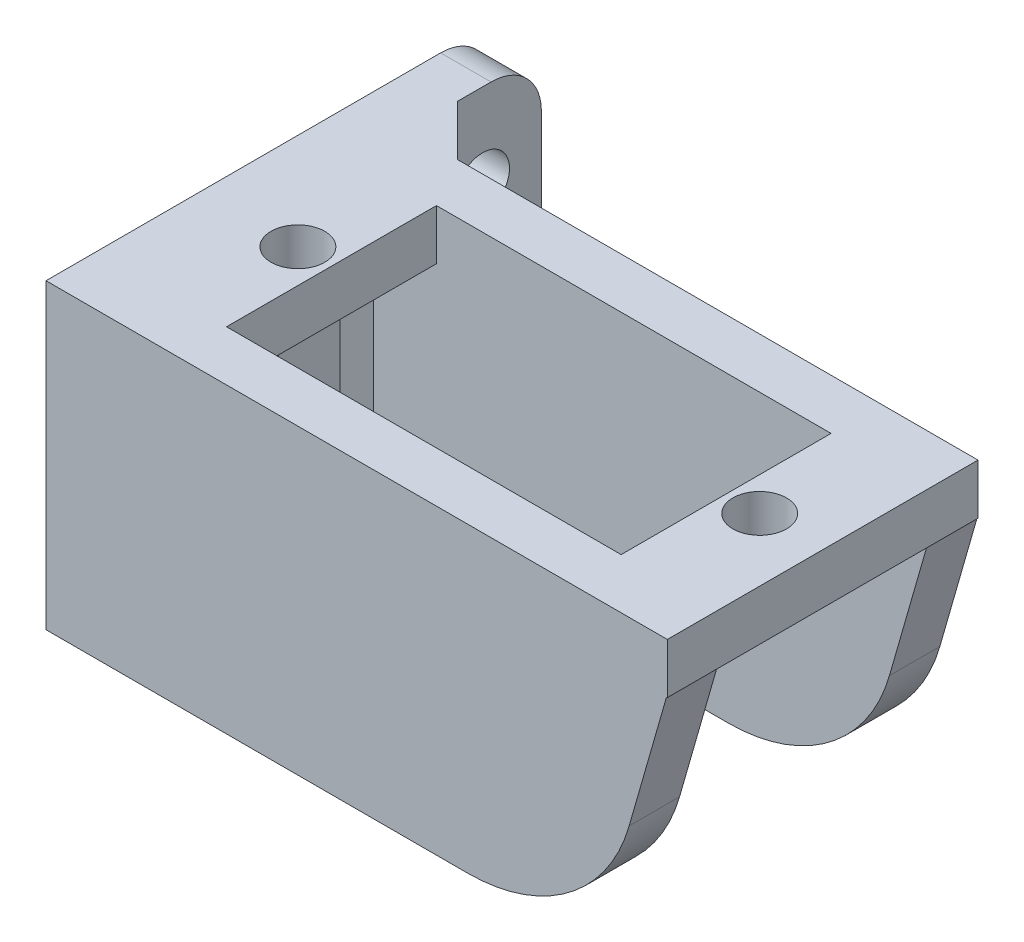
from build123d import *

# Parameters (mm, degrees)
SKETCH_1_W               = 35
SKETCH_1_H               = 18.5
EXTRUDE_1_DEPTH          = 3
SKETCH_2_R               = 1.6
SKETCH_2_W               = 23.5
SKETCH_2_H               = 12.5
CUT_EXTRUDE_1_DEPTH      = 40.702015062
SKETCH_3_W               = 2
SKETCH_3_H               = 18.5
EXTRUDE_2_DEPTH          = 3
EXTRUDE_3_DEPTH          = 15
CHAMFER_1_SIZE           = 19.87826233
CHAMFER_1_SIZE_2         = 5.7
SKETCH_6_R               = 1.6
CUT_EXTRUDE_2_DEPTH      = 42.512046444
SKETCH_8_W               = 3
SKETCH_8_H               = 18
EXTRUDE_4_DEPTH          = 8
CHAMFER_2_SIZE           = 3
CUT_EXTRUDE_3_DEPTH      = 46.642633579
CUT_EXTRUDE_3_DEPTH_BACK = 46.642633579
SKETCH_10_R              = 1.6
SKETCH_11_R              = 2.5
CUT_EXTRUDE_4_DEPTH      = 46.642633579
FILLET_1_R               = 3
FILLET_2_R               = 10
CHAMFER_3_SIZE           = 1


with BuildPart() as part:
    # 草图1 → 凸台-拉伸1 (new body)
    with BuildSketch(Plane(origin=(0, 0, 0), x_dir=(1, 0, 0), z_dir=(0, 1, 0))):
        with Locations((17.5, 9.25)):
            Rectangle(SKETCH_1_W, SKETCH_1_H)
    extrude(amount=EXTRUDE_1_DEPTH)

    # 草图2 → 切除-拉伸1 (cut, through all)
    with BuildSketch(Plane(origin=(0, 3, 0), x_dir=(1, 0, 0), z_dir=(0, 1, 0))):
        with Locations(Location((3.75, 9.25, 0), (0, 0, 270))):
            Circle(SKETCH_2_R)
        with Locations(Location((31.25, 9.25, 0), (0, 0, 270))):
            Circle(SKETCH_2_R)
        with Locations((17.5, 9.25)):
            Rectangle(SKETCH_2_W, SKETCH_2_H)
    extrude(amount=-CUT_EXTRUDE_1_DEPTH, mode=Mode.SUBTRACT)

    # 草图3 → 凸台-拉伸2 (add)
    with BuildSketch(Plane(origin=(0, 3, 0), x_dir=(1, 0, 0), z_dir=(0, 1, 0))):
        with Locations((-1, 9.25)):
            Rectangle(SKETCH_3_W, SKETCH_3_H)
    extrude(amount=-EXTRUDE_2_DEPTH)

    # 草图5 → 凸台-拉伸3 (add)
    with BuildSketch(Plane(origin=(0, 0, 0), x_dir=(-1, 0, 0), z_dir=(0, -1, 0))):
        Polygon((-29.25, 15.5), (-1, 15.5), (-1, 3), (-29.25, 3), (-29.25, 0), (2, 0), (2, 3.75), (2, 16.25), (2, 18.5), (-29.25, 18.5), align=None)
    extrude(amount=EXTRUDE_3_DEPTH)

    # 倒角1
    # the kernel refuses this chamfer: 19.87826233, 5.7 mm, written as the material it adds along each edge
    with BuildSketch(Plane(origin=(29.25, 0, -18.5), x_dir=(-0.010616657410321141, -0.9999436417045873, 0), z_dir=(0, 0, 1))) as chamfer_1_piece_1_section:
        Polygon((CHAMFER_1_SIZE * 0.999943641699, CHAMFER_1_SIZE * 0.0106166574103), (-CHAMFER_1_SIZE_2 * 0.0106166574103, CHAMFER_1_SIZE_2 * 0.999943641705), (0, 0), align=None)
    chamfer_1_piece_1 = extrude(amount=3, mode=Mode.PRIVATE)
    chamfer_1_piece_1 = split(chamfer_1_piece_1, bisect_by=Plane(origin=(31.241878904, -15, -17), z_dir=(0, 1, 0)), keep=Keep.TOP, mode=Mode.PRIVATE)
    add(chamfer_1_piece_1)
    with BuildSketch(Plane(origin=(29.25, 0, -70.109385658), x_dir=(-0.010616657410321141, -0.9999436417045873, 0), z_dir=(0, 0, 1))) as chamfer_1_piece_2_section:
        Polygon((CHAMFER_1_SIZE * 0.999943641699, CHAMFER_1_SIZE * 0.0106166574103), (-CHAMFER_1_SIZE_2 * 0.0106166574103, CHAMFER_1_SIZE_2 * 0.999943641705), (0, 0), align=None)
    chamfer_1_piece_2 = extrude(amount=106.218771315, mode=Mode.PRIVATE)
    chamfer_1_piece_2 = split(chamfer_1_piece_2, bisect_by=Plane(origin=(31.241878904, -5.985247808, 0), z_dir=(0, 0, -1)), keep=Keep.TOP, mode=Mode.PRIVATE)
    chamfer_1_piece_2 = split(chamfer_1_piece_2, bisect_by=Plane(origin=(31.241878904, -5.985247808, -3), z_dir=(0, 0, 1)), keep=Keep.TOP, mode=Mode.PRIVATE)
    chamfer_1_piece_2 = split(chamfer_1_piece_2, bisect_by=Plane(origin=(31.241878904, -15, -1.5), z_dir=(0, 1, 0)), keep=Keep.TOP, mode=Mode.PRIVATE)
    add(chamfer_1_piece_2)
    with BuildSketch(Plane(origin=(29.25, 0, -54.609385658), x_dir=(-0.010616657410321141, -0.9999436417045873, 0), z_dir=(0, 0, 1))) as chamfer_1_piece_3_section:
        Polygon((CHAMFER_1_SIZE * 0.999943641699, CHAMFER_1_SIZE * 0.0106166574103), (-CHAMFER_1_SIZE_2 * 0.0106166574103, CHAMFER_1_SIZE_2 * 0.999943641705), (0, 0), align=None)
    chamfer_1_piece_3 = extrude(amount=106.218771315, mode=Mode.PRIVATE)
    chamfer_1_piece_3 = split(chamfer_1_piece_3, bisect_by=Plane(origin=(31.241878904, -5.985247808, -15.5), z_dir=(0, 0, -1)), keep=Keep.TOP, mode=Mode.PRIVATE)
    chamfer_1_piece_3 = split(chamfer_1_piece_3, bisect_by=Plane(origin=(31.241878904, -5.985247808, -18.5), z_dir=(0, 0, 1)), keep=Keep.TOP, mode=Mode.PRIVATE)
    chamfer_1_piece_3 = split(chamfer_1_piece_3, bisect_by=Plane(origin=(31.241878904, -15, -17), z_dir=(0, 1, 0)), keep=Keep.TOP, mode=Mode.PRIVATE)
    add(chamfer_1_piece_3)
    with BuildSketch(Plane(origin=(29.25, 0, -3), x_dir=(-0.010616657410321141, -0.9999436417045873, 0), z_dir=(0, 0, 1))) as chamfer_1_piece_4_section:
        Polygon((CHAMFER_1_SIZE * 0.999943641699, CHAMFER_1_SIZE * 0.0106166574103), (-CHAMFER_1_SIZE_2 * 0.0106166574103, CHAMFER_1_SIZE_2 * 0.999943641705), (0, 0), align=None)
    chamfer_1_piece_4 = extrude(amount=3, mode=Mode.PRIVATE)
    chamfer_1_piece_4 = split(chamfer_1_piece_4, bisect_by=Plane(origin=(31.241878904, -15, -1.5), z_dir=(0, 1, 0)), keep=Keep.TOP, mode=Mode.PRIVATE)
    add(chamfer_1_piece_4)

    # 草图6 → 切除-拉伸2 (cut, through all)
    with BuildSketch(Plane(origin=(1, 0, 0), x_dir=(0, 0, -1), z_dir=(1, 0, 0))):
        with Locations((9.25, -4.6)):
            Circle(SKETCH_6_R)
        with Locations((9.25, -11.4)):
            Circle(SKETCH_6_R)
    extrude(amount=-CUT_EXTRUDE_2_DEPTH, mode=Mode.SUBTRACT)

    # 草图8 → 凸台-拉伸4 (add)
    with BuildSketch(Plane(origin=(0, 0, -18.5), x_dir=(-1, 0, 0), z_dir=(0, 0, -1))):
        with Locations((0.5, -6)):
            Rectangle(SKETCH_8_W, SKETCH_8_H)
    extrude(amount=EXTRUDE_4_DEPTH)

    # 倒角2
    chamfer_2_edges = [part.edges().sort_by_distance(p)[0] for p in [
        (1, -6, -18.5),
    ]]
    chamfer(chamfer_2_edges, length=CHAMFER_2_SIZE)

    # 草图10 → 切除-拉伸3 (cut, two sides: drawn at the far end of the back side and taken through both)
    with BuildSketch(Plane(origin=(1, 0, 0), x_dir=(0, 0, -1), z_dir=(1, 0, 0)).offset(-CUT_EXTRUDE_3_DEPTH_BACK)):
        with Locations((23, -2)):
            Circle(SKETCH_10_R)
        with Locations((23, -10)):
            Circle(SKETCH_10_R)
    extrude(amount=CUT_EXTRUDE_3_DEPTH + CUT_EXTRUDE_3_DEPTH_BACK, mode=Mode.SUBTRACT)

    # 草图11 → 切除-拉伸4 (cut, through all)
    with BuildSketch(Plane(origin=(1, 0, 0), x_dir=(0, 0, -1), z_dir=(1, 0, 0))):
        with Locations((23, -2)):
            Circle(SKETCH_11_R)
        with Locations((23, -10)):
            Circle(SKETCH_11_R)
    extrude(amount=CUT_EXTRUDE_4_DEPTH, mode=Mode.SUBTRACT)

    # 圆角1
    fillet_1_edges = [part.edges().sort_by_distance(p)[0] for p in [
        (-0.5, 3, -26.5),
        (-0.5, -15, -26.5),
    ]]
    fillet(fillet_1_edges, radius=FILLET_1_R)

    # 圆角2
    fillet_2_edges = [part.edges().sort_by_distance(p)[0] for p in [
        (30.648819214, -15, -17),
        (30.648819214, -15, -1.5),
    ]]
    fillet(fillet_2_edges, radius=FILLET_2_R)

    # 倒角3
    chamfer_3_edges = [part.edges().sort_by_distance(p)[0] for p in [
        (1, -7.5, -15.5),
        (1, -7.5, -3),
    ]]
    chamfer(chamfer_3_edges, length=CHAMFER_3_SIZE)


solid = part.part
